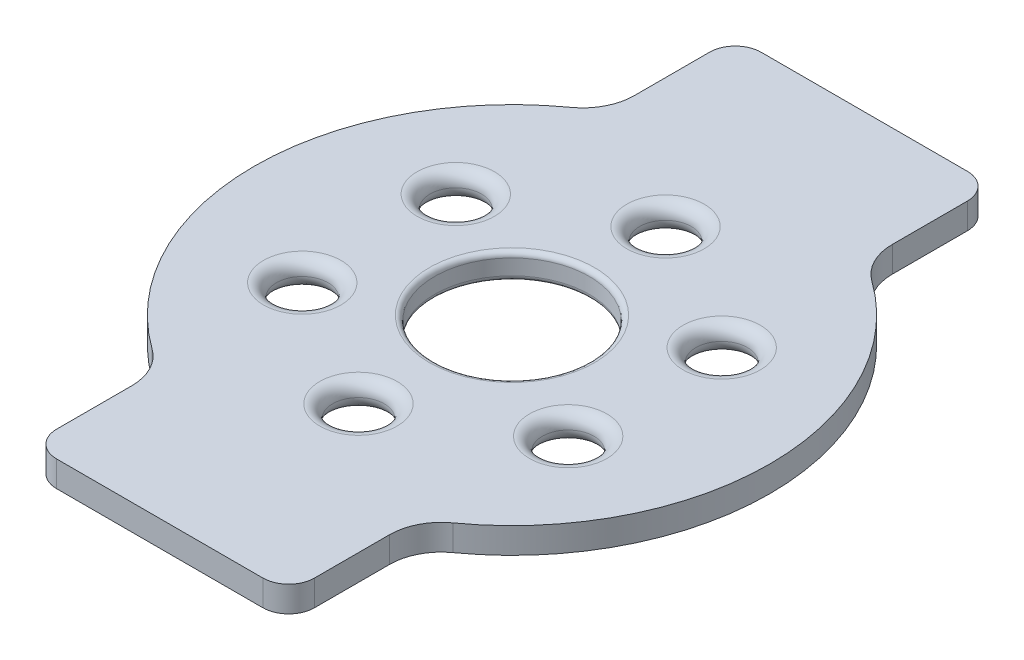
from build123d import *

# Parameters (mm, degrees)
ESBO_O1_R                = 30
RESSALTO_EXTRUS_O1_DEPTH = 10
FILETE1_R                = 20
FILETE2_R                = 2
FILETE3_R                = 10
FILETE4_R                = 10
ESBO_O2_R                = 10
CORTE_EXTRUS_O1_DEPTH    = 170.58848439
FILETE5_R                = 5


with BuildPart() as part:
    # Esboço1 → Ressalto-extrusão1 (new body)
    with BuildSketch(Plane(origin=(0, 0, 0), x_dir=(1, 0, 0), z_dir=(0, 1, 0))):
        with BuildLine():
            Line((-50, 136.602540378), (50, 136.602540378))
            Line((50, 136.602540378), (50, 86.602540378))
            ThreePointArc((50, 86.602540378), (100, 0), (50, -86.602540378))
            Line((50, -86.602540378), (50, -136.602540378))
            Line((50, -136.602540378), (-50, -136.602540378))
            Line((-50, -136.602540378), (-50, -86.602540378))
            ThreePointArc((-50, -86.602540378), (-100, 0), (-50, 86.602540378))
            Line((-50, 86.602540378), (-50, 136.602540378))
        make_face()
        with Locations(Location((0, 0, 0), (0, 0, 270))):
            Circle(ESBO_O1_R, mode=Mode.SUBTRACT)
    extrude(amount=RESSALTO_EXTRUS_O1_DEPTH)

    # Filete1
    filete1_edges = [part.edges().sort_by_distance(p)[0] for p in [
        (50, 5, -86.602540378),
        (50, 5, 86.602540378),
        (-50, 5, 86.602540378),
        (-50, 5, -86.602540378),
    ]]
    fillet(filete1_edges, radius=FILETE1_R)

    # Filete2
    filete2_edges = [part.edges().sort_by_distance(p)[0] for p in [
        (0, 0, -30),
        (0, 10, -30),
    ]]
    fillet(filete2_edges, radius=FILETE2_R)

    # Filete3
    filete3_edges = [part.edges().sort_by_distance(p)[0] for p in [
        (50, 5, 136.602540378),
        (-50, 5, 136.602540378),
    ]]
    fillet(filete3_edges, radius=FILETE3_R)

    # Filete4
    filete4_edges = [part.edges().sort_by_distance(p)[0] for p in [
        (-50, 5, -136.602540378),
        (50, 5, -136.602540378),
    ]]
    fillet(filete4_edges, radius=FILETE4_R)

    # Esboço2 → Corte-extrusão1 (cut, through all)
    with BuildSketch(Plane(origin=(0, 10, 0), x_dir=(1, 0, 0), z_dir=(0, 1, 0))):
        with Locations(Location((0, 59.539997486, 0), (0, 0, 270))):
            Circle(ESBO_O2_R)
        with Locations(Location((51.563150364, 29.769998743, 0), (0, 0, 270))):
            Circle(ESBO_O2_R)
        with Locations(Location((51.563150364, -29.769998743, 0), (0, 0, 270))):
            Circle(ESBO_O2_R)
        with Locations(Location((0, -59.539997486, 0), (0, 0, 270))):
            Circle(ESBO_O2_R)
        with Locations(Location((-51.563150364, -29.769998743, 0), (0, 0, 270))):
            Circle(ESBO_O2_R)
        with Locations(Location((-51.563150364, 29.769998743, 0), (0, 0, 270))):
            Circle(ESBO_O2_R)
    extrude(amount=-CORTE_EXTRUS_O1_DEPTH, mode=Mode.SUBTRACT)

    # Filete5
    filete5_edges = [part.edges().sort_by_distance(p)[0] for p in [
        (0, 0, -69.539997486),
        (0, 10, -69.539997486),
        (-51.563150364, 0, -39.769998743),
        (-51.563150364, 10, -39.769998743),
        (-51.563150364, 0, 19.769998743),
        (-51.563150364, 10, 19.769998743),
        (0, 0, 49.539997486),
        (0, 10, 49.539997486),
        (51.563150364, 0, 19.769998743),
        (51.563150364, 10, 19.769998743),
        (51.563150364, 0, -39.769998743),
        (51.563150364, 10, -39.769998743),
    ]]
    fillet(filete5_edges, radius=FILETE5_R - 0.0001)  # a hair under: the kernel refuses the full size


solid = part.part
